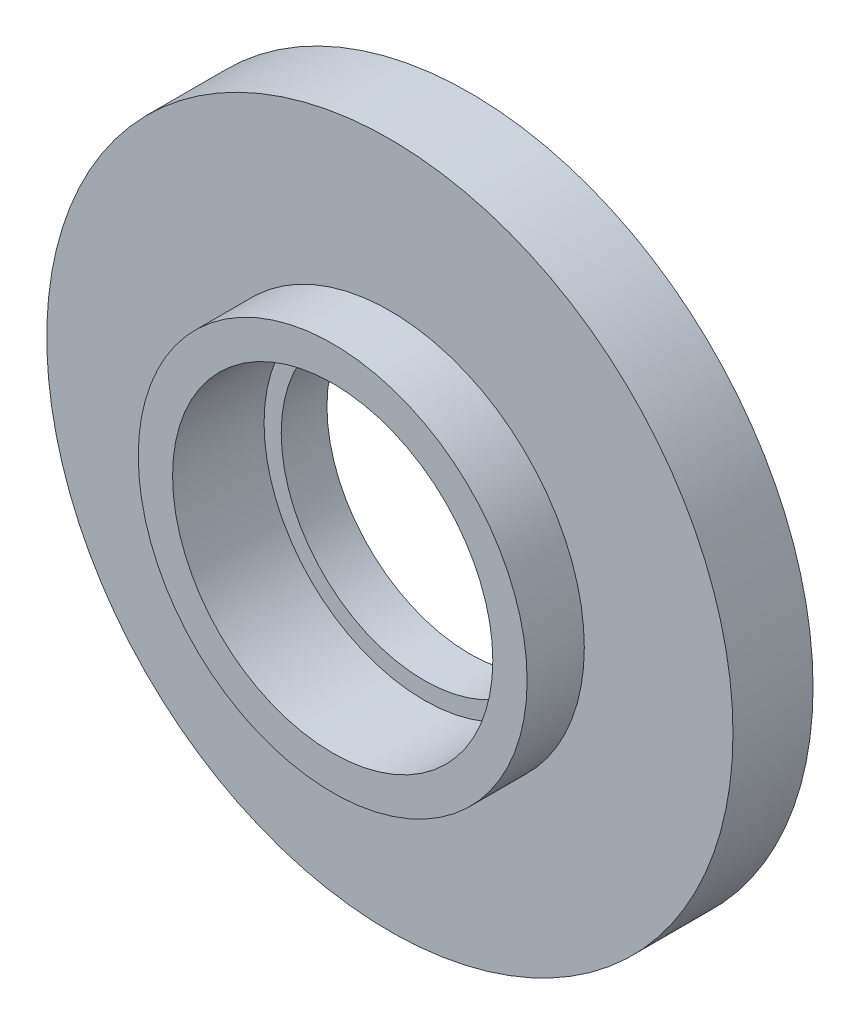
from build123d import *

# Parameters (mm, degrees)
SKETCH4_R          = 14
CUT_EXTRUDE1_DEPTH = 8
SKETCH5_R          = 12.5
CUT_EXTRUDE4_DEPTH = 8.1
SKETCH7_R          = 2.5
CUT_EXTRUDE5_DEPTH = 3


with BuildPart() as part:
    # Sketch2 → Revolve4 (revolve)
    with BuildSketch(Plane(origin=(0, 0, 0), x_dir=(1, 0, 0), z_dir=(0, 1, 0))):
        Polygon((0, 0), (-30, 0), (-30, -7), (-17, -7), (-17, -12), (0, -12), align=None)
    revolve(axis=Axis((0, 0, 12), (0, 0, -1)))

    # Sketch4 → Cut-Extrude1 (cut)
    with BuildSketch(Plane.XY.offset(12)):
        Circle(SKETCH4_R)
    extrude(amount=-CUT_EXTRUDE1_DEPTH, mode=Mode.SUBTRACT)

    # Sketch5 → Cut-Extrude4 (cut)
    with BuildSketch(Plane(origin=(0, 0, 0), x_dir=(-1, 0, 0), z_dir=(0, 0, -1))):
        Circle(SKETCH5_R)
    extrude(amount=-CUT_EXTRUDE4_DEPTH, mode=Mode.SUBTRACT)

    # Sketch7 → Cut-Extrude5 (cut)
    with BuildSketch(Plane(origin=(0, 0, 0), x_dir=(-1, 0, 0), z_dir=(0, 0, -1))):
        with Locations((0, 23)):
            Circle(SKETCH7_R)
        with Locations((19.918584287, 11.5)):
            Circle(SKETCH7_R)
        with Locations((19.918584287, -11.5)):
            Circle(SKETCH7_R)
        with Locations((0, -23)):
            Circle(SKETCH7_R)
        with Locations((-19.918584287, -11.5)):
            Circle(SKETCH7_R)
        with Locations((-19.918584287, 11.5)):
            Circle(SKETCH7_R)
    extrude(amount=-CUT_EXTRUDE5_DEPTH, mode=Mode.SUBTRACT)


solid = part.part
